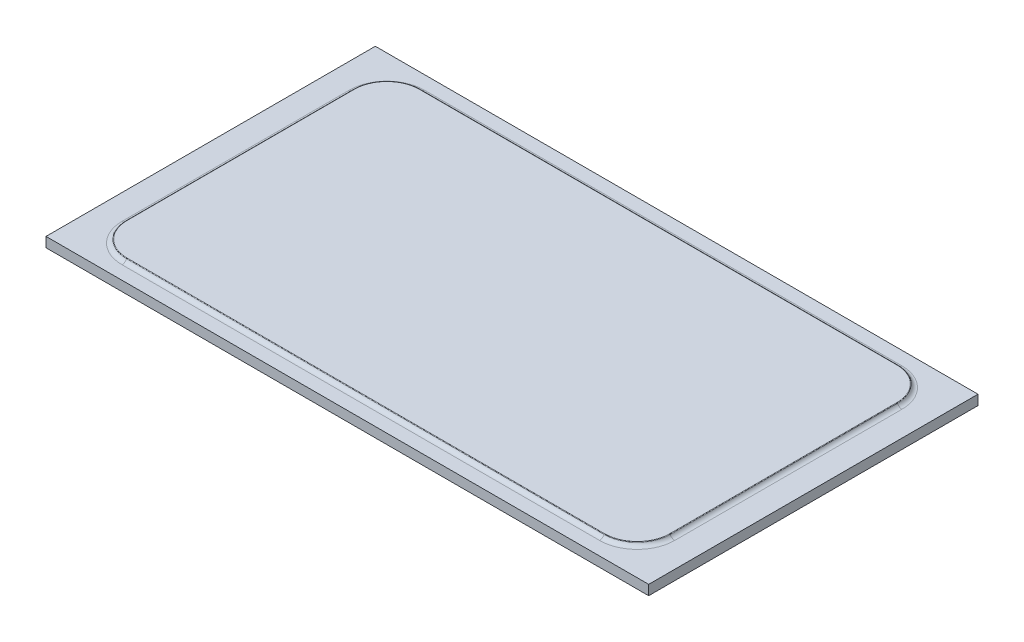
from build123d import *

# Parameters (mm, degrees)
SKETCH_1_W      = 183
SKETCH_1_H      = 100
EXTRUDE_1_DEPTH = 3
SKETCH_2_W      = 165
SKETCH_2_H      = 89
EXTRUDE_2_DEPTH = 1
FILLET_1_R      = 10
FILLET_2_R      = 1.5
FILLET_3_R      = 0.2


with BuildPart() as part:
    # 草图1 → 凸台-拉伸1 (new body)
    with BuildSketch(Plane(origin=(0, 0, 0), x_dir=(1, 0, 0), z_dir=(0, 1, 0))):
        Rectangle(SKETCH_1_W, SKETCH_1_H)
    extrude(amount=EXTRUDE_1_DEPTH)

    # 草图2 → 凸台-拉伸2 (add)
    with BuildSketch(Plane(origin=(0, 3, 0), x_dir=(1, 0, 0), z_dir=(0, 1, 0))):
        Rectangle(SKETCH_2_W, SKETCH_2_H)
    extrude(amount=EXTRUDE_2_DEPTH)

    # 圆角1
    fillet_1_edges = [part.edges().sort_by_distance(p)[0] for p in [
        (-82.5, 3.5, -44.5),
        (-82.5, 3.5, 44.5),
        (82.5, 3.5, 44.5),
        (82.5, 3.5, -44.5),
    ]]
    fillet(fillet_1_edges, radius=FILLET_1_R)

    # 圆角2
    # the kernel refuses this fillet: 1.5 mm, written as the material it adds along each edge
    with BuildSketch(Plane(origin=(-72.5, 3, 34.5), x_dir=(-1, 0, 0), z_dir=(0, 0, -1))) as fillet_2_piece_1:
        with BuildLine():
            CenterArc((11.414213562, 1.5), FILLET_2_R, 199.471220634, 70.528779366)
            Line((10, 1), (9.971715729, 0.99))
            ThreePointArc((9.971715729, 0.99), (9.97, 0.5), (9.97, 0))
            Line((9.97, 0), (10, -0.03))
            Line((10, -0.03), (11.414213562, -0.03))
            Line((11.414213562, -0.03), (11.414213562, 0))
        make_face()
    revolve(axis=Axis((-72.5, 3, 34.5), (0, 1, 0)), revolution_arc=90)
    with BuildSketch(Plane(origin=(-82.5, 3, -34.5), x_dir=(-1, 0, 0), z_dir=(0, 0, 1)), Plane(origin=(82.5, 3, 34.5), x_dir=(1, 0, 0), z_dir=(0, 0, -1))) as fillet_2_piece_2:
        with BuildLine():
            CenterArc((1.414213562, -1.5), FILLET_2_R, 90, 70.528779366)
            Line((0, -1), (-0.028284271, -0.99))
            ThreePointArc((-0.028284271, -0.99), (-0.03, -0.5), (-0.03, 0))
            Line((-0.03, 0), (0, 0.03))
            Line((0, 0.03), (1.414213562, 0.03))
            Line((1.414213562, 0.03), (1.414213562, 0))
        make_face()
    extrude(amount=69)
    with BuildSketch(Plane(origin=(-72.5, 3, -34.5), x_dir=(0, 0, -1), z_dir=(1, 0, 0))) as fillet_2_piece_3:
        with BuildLine():
            CenterArc((11.414213562, 1.5), FILLET_2_R, 199.471220634, 70.528779366)
            Line((10, 1), (9.971715729, 0.99))
            ThreePointArc((9.971715729, 0.99), (9.97, 0.5), (9.97, 0))
            Line((9.97, 0), (10, -0.03))
            Line((10, -0.03), (11.414213562, -0.03))
            Line((11.414213562, -0.03), (11.414213562, 0))
        make_face()
    revolve(axis=Axis((-72.5, 3, -34.5), (0, 1, 0)), revolution_arc=90)
    with BuildSketch(Plane(origin=(72.5, 3, -44.5), x_dir=(0, 0, -1), z_dir=(-1, 0, 0)), Plane(origin=(-72.5, 3, 44.5), x_dir=(0, 0, 1), z_dir=(1, 0, 0))) as fillet_2_piece_4:
        with BuildLine():
            CenterArc((1.414213562, -1.5), FILLET_2_R, 90, 70.528779366)
            Line((0, -1), (-0.028284271, -0.99))
            ThreePointArc((-0.028284271, -0.99), (-0.03, -0.5), (-0.03, 0))
            Line((-0.03, 0), (0, 0.03))
            Line((0, 0.03), (1.414213562, 0.03))
            Line((1.414213562, 0.03), (1.414213562, 0))
        make_face()
    extrude(amount=145)
    with BuildSketch(Plane(origin=(72.5, 3, -34.5), x_dir=(0, 0, -1), z_dir=(-1, 0, 0))) as fillet_2_piece_5:
        with BuildLine():
            CenterArc((11.414213562, -1.5), FILLET_2_R, 90, 70.528779366)
            Line((10, -1), (9.971715729, -0.99))
            ThreePointArc((9.971715729, -0.99), (9.97, -0.5), (9.97, 0))
            Line((9.97, 0), (10, 0.03))
            Line((10, 0.03), (11.414213562, 0.03))
            Line((11.414213562, 0.03), (11.414213562, 0))
        make_face()
    revolve(axis=Axis((72.5, 3, -34.5), (0, -1, 0)), revolution_arc=90)
    with BuildSketch(Plane(origin=(72.5, 3, 34.5), x_dir=(0, 0, 1), z_dir=(-1, 0, 0))) as fillet_2_piece_6:
        with BuildLine():
            CenterArc((11.414213562, 1.5), FILLET_2_R, 199.471220634, 70.528779366)
            Line((10, 1), (9.971715729, 0.99))
            ThreePointArc((9.971715729, 0.99), (9.97, 0.5), (9.97, 0))
            Line((9.97, 0), (10, -0.03))
            Line((10, -0.03), (11.414213562, -0.03))
            Line((11.414213562, -0.03), (11.414213562, 0))
        make_face()
    revolve(axis=Axis((72.5, 3, 34.5), (0, 1, 0)), revolution_arc=90)

    # 圆角3
    fillet_3_edges = [part.edges().sort_by_distance(p)[0] for p in [
        (-82.5, 4, 0),
        (0, 4, -44.5),
        (0, 4, 44.5),
        (82.5, 4, 0),
        (-79.571067812, 4, 41.571067812),
        (79.571067812, 4, 41.571067812),
        (79.571067812, 4, -41.571067812),
        (-79.571067812, 4, -41.571067812),
    ]]
    fillet(fillet_3_edges, radius=FILLET_3_R)


solid = part.part
